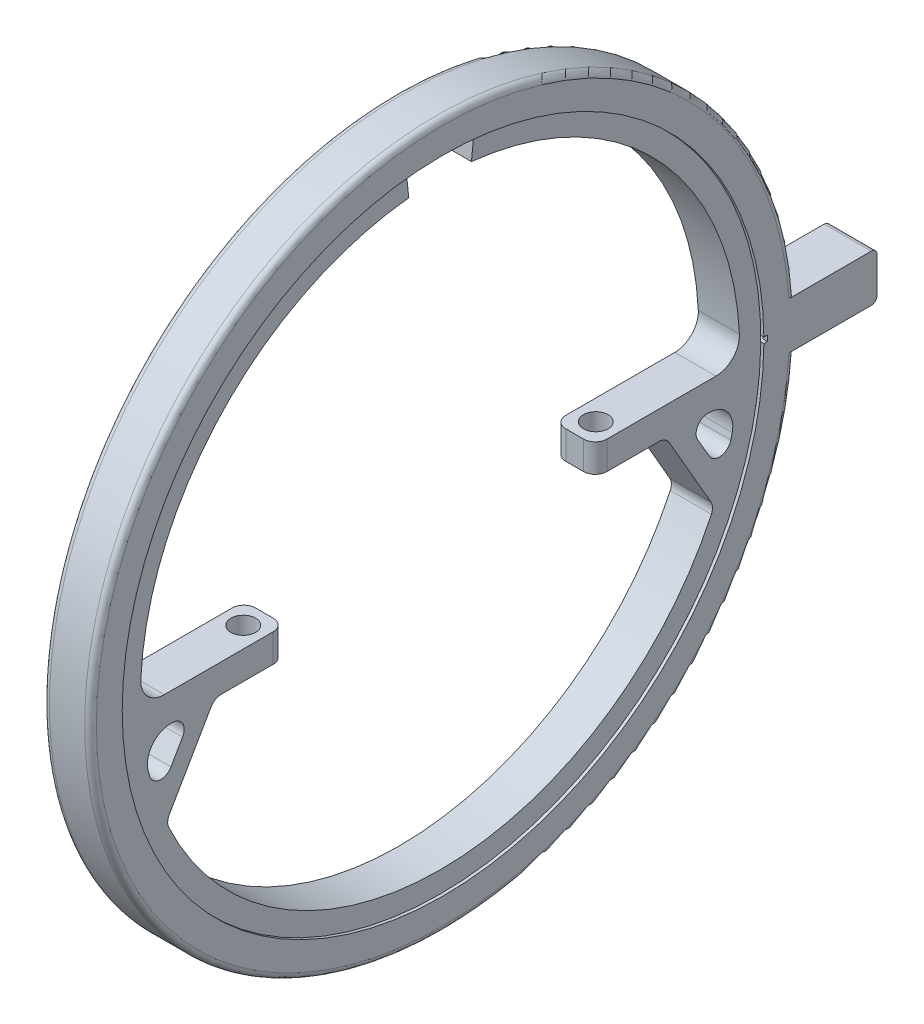
from build123d import *

# Parameters (mm, degrees)
REVOLVE2_ANGLE      = 174
BOSS_EXTRUDE1_START = -1.75
BOSS_EXTRUDE1_DEPTH = 3.5
FILLET1_R           = 2
FILLET2_R           = 1
CUT_EXTRUDE1_REACH  = 44.474
SKETCH4_R           = 1.05
SKETCH5_W           = 7
SKETCH5_H           = 4
BOSS_EXTRUDE2_DEPTH = 2
CUT_REVOLVE1_ANGLE  = 1
FILLET3_R           = 0.5
FILLET4_R           = 0.5
FILLET5_R           = 1


# Read off the part's stored shape, not the designer's step: Revolve2
with BuildPart() as part:
    # Sketch2 → Revolve1 (revolve)
    with BuildSketch(Plane(origin=(0, 0, 0), x_dir=(1, 0, 0), z_dir=(0, 1, 0)), mode=Mode.PRIVATE) as revolve1_sk:
        Polygon((-0.5, 28.5), (0, 28.5), (0, 30), (-2, 30), (-2, 27.3), (-1.506919557, 27.3), align=None)
    revolve1 = revolve(revolve1_sk.sketch.rotate(Axis((0, 0, 0), (1, 0, 0)), 180), axis=Axis((0, 0, 0), (1, 0, 0)))


with BuildPart() as body_2:
    # Revolve2 outline → Revolve2 (revolve)
    with BuildSketch(Plane(origin=(0, 0, 0), x_dir=(0, -1, 0), z_dir=(0, 0, 1))):
        Polygon((25.5, 0), (25.5, -1.75), (27.29, -1.75), (27.29, -1.502256481), (28.491219063, -0.494314008), (28.491219063, 0), align=None)
    revolve2 = revolve(axis=Axis((0, 0, 0), (1, 0, 0)), revolution_arc=REVOLVE2_ANGLE)


with BuildPart() as part_1:
    add(part.part)

    add(body_2.part)  # Mirror1 merges body 2
    # Mirror1: Revolve1, Revolve2 across plane
    add(revolve1.mirror(Plane(origin=(0, 0, 0), x_dir=(0, 0, 1), z_dir=(1, 0, 0))))
    add(revolve2.mirror(Plane(origin=(0, 0, 0), x_dir=(0, 0, 1), z_dir=(1, 0, 0))))

    # Sketch3 → Boss-Extrude1 (add)
    with BuildSketch(Plane(origin=(0, 0, 0), x_dir=(0, 0, -1), z_dir=(1, 0, 0)).offset(BOSS_EXTRUDE1_START)):
        with BuildLine():
            ThreePointArc((25.292044204, -3.25), (25.417279788, -2.052288521), (25.485829396, -0.85))
            Line((25.485829396, -0.85), (13.2, -0.85))
            Line((13.2, -0.85), (13.2, -3.25))
            Line((13.2, -3.25), (19.2, -3.25))
            Line((19.2, -3.25), (23.302526372, -10.355784116))
            ThreePointArc((23.302526372, -10.355784116), (23.69804938, -9.415543296), (24.055652184, -8.460236286))
            Line((24.055652184, -8.460236286), (21.047520861, -3.25))
            Line((21.047520861, -3.25), (25.292044204, -3.25))
        make_face()
    extrude(amount=BOSS_EXTRUDE1_DEPTH)

    # Fillet1
    fillet1_edges = [part_1.edges().sort_by_distance(p)[0] for p in [
        (0, -0.85, -25.485829396),
        (0, -3.25, -25.292044204),
    ]]
    fillet(fillet1_edges, radius=FILLET1_R)

    # Fillet2
    fillet2_edges = [part_1.edges().sort_by_distance(p)[0] for p in [
        (0, -3.25, -21.047520861),
        (0, -8.460236286, -24.055652184),
        (0, -10.355784116, -23.302526372),
        (0, -3.25, -19.2),
    ]]
    fillet(fillet2_edges, radius=FILLET2_R)

    # Sketch4 → Cut-Extrude1 (cut, up to next)
    with BuildSketch(Plane(origin=(0, 0, 0), x_dir=(1, 0, 0), z_dir=(0, 1, 0)), mode=Mode.PRIVATE) as cut_extrude1_sk1:
        with Locations(Location((0, 15, 0), (0, 0, 270))):
            Circle(SKETCH4_R)
    cut_extrude1_tool1 = extrude(cut_extrude1_sk1.sketch, amount=-CUT_EXTRUDE1_REACH, mode=Mode.PRIVATE) & part_1.part
    add(cut_extrude1_tool1.solids().sort_by_distance((0, 0, -15))[0], mode=Mode.SUBTRACT)

    # Mirror2: part across plane


with BuildPart() as part_2:
    add(part_1.part)
    add(part_1.part.mirror(Plane.XY))

    # Sketch5 → Boss-Extrude2 (add, symmetric)
    with BuildSketch(Plane(origin=(0, 0, 0), x_dir=(0, 0, -1), z_dir=(1, 0, 0))):
        with Locations((33.433259094, 0)):
            Rectangle(SKETCH5_W, SKETCH5_H)
    extrude(amount=BOSS_EXTRUDE2_DEPTH, both=True)

    # Sketch6 → Cut-Revolve1 (revolve, symmetric, cut)
    with BuildSketch(Plane(origin=(0, 0, 0), x_dir=(1, 0, 0), z_dir=(0, 1, 0))) as cut_revolve1_sk:
        Polygon((-2, 27.6), (-2, 27.3), (-1.506919557, 27.3), (-0.5, 28.5), (0, 28.5), (0, 28.8), (-0.639892297, 28.8), (-1.646811855, 27.6), align=None)
    cut_revolve1 = revolve(axis=Axis((0, 0, 0), (1, 0, 0)), revolution_arc=CUT_REVOLVE1_ANGLE / 2, mode=Mode.SUBTRACT)
    cut_revolve1 = cut_revolve1 + revolve(cut_revolve1_sk.sketch, axis=Axis((0, 0, 0), (-1, 0, 0)), revolution_arc=CUT_REVOLVE1_ANGLE / 2, mode=Mode.SUBTRACT)

    # Mirror3: Cut-Revolve1 across plane
    add(cut_revolve1.mirror(Plane(origin=(0, 0, 0), x_dir=(0, 0, 1), z_dir=(1, 0, 0))), mode=Mode.SUBTRACT)

    # Fillet3
    fillet3_edges = [part_2.edges().sort_by_distance(p)[0] for p in [
        (0, 2, -36.933259094),
        (0, -2, -36.933259094),
    ]]
    fillet(fillet3_edges, radius=FILLET3_R)

    # Fillet4
    fillet4_edges = [part_2.edges().sort_by_distance(p)[0] for p in [
        (2, -29.983310131, 1.000556639),
        (-2, -29.983310131, 1.000556639),
    ]]
    fillet(fillet4_edges, radius=FILLET4_R)

    # Fillet5
    fillet5_edges = [part_2.edges().sort_by_distance(p)[0] for p in [
        (1.75, -2.05, 13.2),
        (-1.75, -2.05, 13.2),
        (1.75, -2.05, -13.2),
        (-1.75, -2.05, -13.2),
    ]]
    fillet(fillet5_edges, radius=FILLET5_R)


solid = part_2.part
